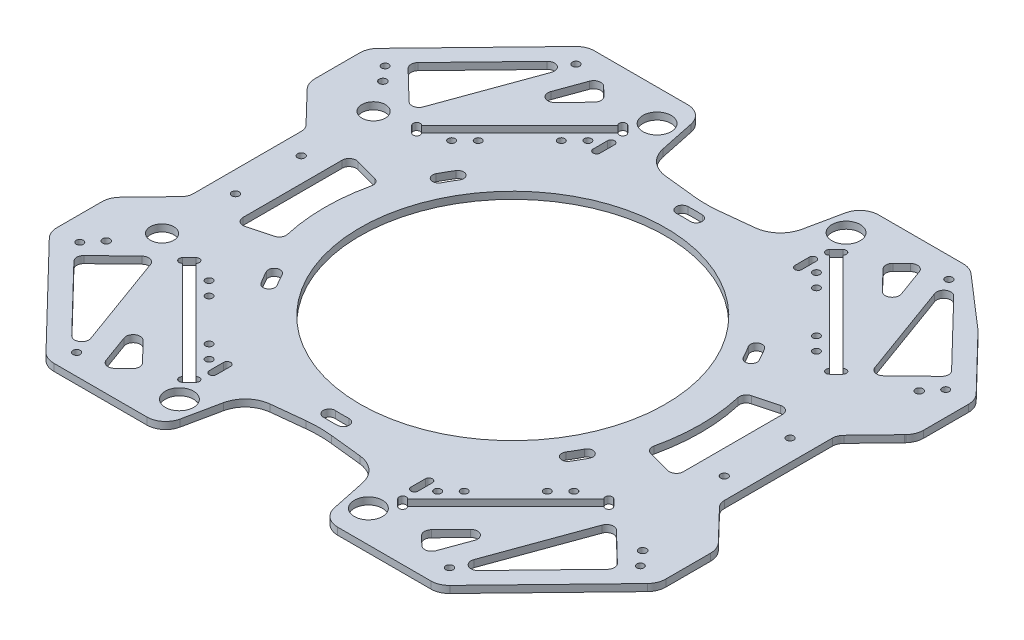
from build123d import *

# Parameters (mm, degrees)
SKETCH_2_R                                 = 1.5
SKETCH_2_R_2                               = 6
SKETCH_2_R_3                               = 2.5
SKETCH_2_R_4                               = 65
EXTRUDE_1_DEPTH                            = 3
CUT_EXTRUDE_1_DEPTH                        = 10
SKETCH_4_W                                 = 371.78166001
SKETCH_4_H                                 = 92.770790776
CUT_EXTRUDE_2_DEPTH                        = 10
CUT_EXTRUDE_3_DEPTH                        = 10
CUT_EXTRUDE_4_DEPTH                        = 10
MIRROR_3_COPY_1_DEPTH                      = 10
MIRROR_3_COPY_2_DEPTH                      = 10
SKETCH_13_R                                = 1.5
CUT_EXTRUDE_7_DEPTH                        = 10
MIRROR_4_AT_THE_SECOND_PLANE_COPY_1_SKET_R = 1.5
MIRROR_4_AT_THE_SECOND_PLANE_COPY_1_DEPTH  = 10
CUT_EXTRUDE_8_DEPTH                        = 10
FILLET_1_R                                 = 10
CUT_EXTRUDE_9_DEPTH                        = 10
FILLET_3_R                                 = 3
MIRROR_START                               = -3
MIRROR_7_DEPTH                             = 3
FILLET_4_R                                 = 10
SKETCH_27_R                                = 6
EXTRUDE_2_DEPTH                            = 3
CUT_EXTRUDE_10_DEPTH                       = 3
MIRROR_11_COPY_1_DEPTH                     = 3
FILLET_5_R                                 = 8
SKETCH_30_R                                = 5
CUT_EXTRUDE_11_DEPTH                       = 3
CUT_EXTRUDE_12_DEPTH                       = 3
FILLET_6_R                                 = 3
CUT_EXTRUDE_13_DEPTH                       = 3
FILLET_7_R                                 = 5
CUT_EXTRUDE_15_DEPTH                       = 10
PATTERN_CIRCULAR_1_COUNT                   = 6
CUT_EXTRUDE_16_DEPTH                       = 3
FILLET_8_R                                 = 8
SKETCH_35_R                                = 1.6
SKETCH_35_R_2                              = 1.55
CUT_EXTRUDE_17_DEPTH                       = 3


# Read off the part's stored shape, not the designer's step: 镜向7
with BuildPart() as part:
    # 草图2 → 凸台-拉伸1 (new body)
    with BuildSketch(Plane(origin=(0, 0, 0), x_dir=(1, 0, 0), z_dir=(0, 1, 0))):
        with BuildLine():
            Line((27.570452121, -570.945673808), (-65.284171465, -616.487071224))
            ThreePointArc((-65.284171465, -616.487071224), (-70.183566605, -620.913167557), (-72, -627.260999566))
            Line((-72, -627.260999566), (-72, -702.260999566))
            ThreePointArc((-72, -702.260999566), (-71.124572855, -706.760319382), (-68.626020199, -710.60316808))
            Line((-68.626020199, -710.60316808), (-4.161661177, -777.260999566))
            Line((-4.161661177, -777.260999566), (18.01022402, -777.260999566))
            ThreePointArc((18.01022402, -777.260999566), (25.574796805, -774.5764297), (29.754765565, -767.723872662))
            Line((29.754765565, -767.723872662), (35.416944963, -740.723008804))
            ThreePointArc((35.416944963, -740.723008804), (39.119130023, -734.339507602), (45.85666052, -731.329367302))
            Line((45.85666052, -731.329367302), (59.628943001, -729.841322608))
            ThreePointArc((59.628943001, -729.841322608), (65, -729.552003017), (70.371056999, -729.841322608))
            Line((70.371056999, -729.841322608), (84.14333948, -731.329367302))
            ThreePointArc((84.14333948, -731.329367302), (90.88747655, -734.345456618), (94.586801163, -740.740390313))
            Line((94.586801163, -740.740390313), (100.245234435, -767.723872662))
            ThreePointArc((100.245234435, -767.723872662), (104.425203195, -774.5764297), (111.98977598, -777.260999566))
            Line((111.98977598, -777.260999566), (134.161661177, -777.260999566))
            Line((134.161661177, -777.260999566), (198.626020199, -710.60316808))
            ThreePointArc((198.626020199, -710.60316808), (201.124572855, -706.760319382), (202, -702.260999566))
            Line((202, -702.260999566), (202, -627.260999566))
            ThreePointArc((202, -627.260999566), (200.183566605, -620.913167557), (195.284171465, -616.487071224))
            Line((195.284171465, -616.487071224), (102.429547879, -570.945673808))
            ThreePointArc((102.429547879, -570.945673808), (65, -562.260999566), (27.570452121, -570.945673808))
        make_face()
        with Locations(Location((-54.25, -712.220291709, 0), (0, 0, 270))):
            Circle(SKETCH_2_R, mode=Mode.SUBTRACT)
        with Locations(Location((24.797056939, -748.876687148, 0), (0, 0, 270))):
            Circle(SKETCH_2_R_2, mode=Mode.SUBTRACT)
        with BuildLine():
            Line((20.591308189, -731.989656145), (20.591308189, -725.864180236))
            ThreePointArc((20.591308189, -725.864180236), (22.091308189, -724.364180236), (23.591308189, -725.864180236))
            Line((23.591308189, -725.864180236), (23.591308189, -731.989656145))
            ThreePointArc((23.591308189, -731.989656145), (22.091308189, -733.489656145), (20.591308189, -731.989656145))
        make_face(mode=Mode.SUBTRACT)
        with Locations(Location((-60, -702.260999566, 0), (0, 0, 270))):
            Circle(SKETCH_2_R_2, mode=Mode.SUBTRACT)
        with Locations(Location((-0.081809094, -684.835999566, 0), (0, 0, 270))):
            Circle(SKETCH_2_R_3, mode=Mode.SUBTRACT)
        with Locations(Location((105.202943061, -748.876687148, 0), (0, 0, 270))):
            Circle(SKETCH_2_R_2, mode=Mode.SUBTRACT)
        with BuildLine():
            ThreePointArc((65, -724.910999566), (62.5, -722.410999566), (65, -719.910999566))
            ThreePointArc((65, -719.910999566), (67.5, -722.410999566), (65, -724.910999566))
        make_face(mode=Mode.SUBTRACT)
        with BuildLine():
            ThreePointArc((106.408691811, -725.864180236), (107.908691811, -724.364180236), (109.408691811, -725.864180236))
            Line((109.408691811, -725.864180236), (109.408691811, -731.989656145))
            ThreePointArc((109.408691811, -731.989656145), (107.908691811, -733.489656145), (106.408691811, -731.989656145))
            Line((106.408691811, -731.989656145), (106.408691811, -725.864180236))
        make_face(mode=Mode.SUBTRACT)
        with Locations(Location((184.25, -712.220291709, 0), (0, 0, 270))):
            Circle(SKETCH_2_R, mode=Mode.SUBTRACT)
        with Locations(Location((130.081809094, -684.835999566, 0), (0, 0, 270))):
            Circle(SKETCH_2_R_3, mode=Mode.SUBTRACT)
        with Locations(Location((190, -702.260999566, 0), (0, 0, 270))):
            Circle(SKETCH_2_R_2, mode=Mode.SUBTRACT)
        with Locations(Location((-60, -627.260999566, 0), (0, 0, 270))):
            Circle(SKETCH_2_R_2, mode=Mode.SUBTRACT)
        with Locations(Location((-54.25, -617.301707422, 0), (0, 0, 270))):
            Circle(SKETCH_2_R, mode=Mode.SUBTRACT)
        with Locations(Location((65, -647.260999566, 0), (0, 0, 270))):
            Circle(SKETCH_2_R_4, mode=Mode.SUBTRACT)
        with Locations(Location((-0.081809094, -609.685999566, 0), (0, 0, 270))):
            Circle(SKETCH_2_R_3, mode=Mode.SUBTRACT)
        with Locations(Location((190, -627.260999566, 0), (0, 0, 270))):
            Circle(SKETCH_2_R_2, mode=Mode.SUBTRACT)
        with Locations(Location((184.25, -617.301707422, 0), (0, 0, 270))):
            Circle(SKETCH_2_R, mode=Mode.SUBTRACT)
        with Locations(Location((130.081809094, -609.685999566, 0), (0, 0, 270))):
            Circle(SKETCH_2_R_3, mode=Mode.SUBTRACT)
        with Locations(Location((65, -572.110999566, 0), (0, 0, 270))):
            Circle(SKETCH_2_R_3, mode=Mode.SUBTRACT)
    extrude(amount=-EXTRUDE_1_DEPTH)

    # 草图3 → 切除-拉伸1 (cut)
    with BuildSketch(Plane(origin=(0, 0, 0), x_dir=(1, 0, 0), z_dir=(0, 1, 0))):
        with BuildLine():
            Line((121.515873197, -588.535574618), (85.947308959, -570.719199778))
            ThreePointArc((85.947308959, -570.719199778), (80.541899521, -572.516670259), (82.339370002, -577.922079697))
            Line((82.339370002, -577.922079697), (117.90793424, -595.738454537))
            ThreePointArc((117.90793424, -595.738454537), (123.313343678, -593.940984056), (121.515873197, -588.535574618))
        make_face()
        with BuildLine():
            ThreePointArc((138.469569232, -635.803502563), (139.848703905, -637.420135509), (141.952746293, -637.717658878))
            Line((141.952746293, -637.717658878), (165.133796995, -632.496332821))
            ThreePointArc((165.133796995, -632.496332821), (166.220460826, -631.256816273), (165.374149259, -629.842250515))
            Line((165.374149259, -629.842250515), (135.315336706, -617.056624431))
            ThreePointArc((135.315336706, -617.056624431), (133.159820875, -617.442493306), (132.649858287, -619.572066372))
            Line((132.649858287, -619.572066372), (138.469569232, -635.803502563))
        make_face()
        with BuildLine():
            ThreePointArc((47.660629998, -577.922079697), (49.458100479, -572.516670259), (44.052691041, -570.719199778))
            Line((44.052691041, -570.719199778), (8.484126803, -588.535574618))
            ThreePointArc((8.484126803, -588.535574618), (6.686656322, -593.940984056), (12.09206576, -595.738454537))
            Line((12.09206576, -595.738454537), (47.660629998, -577.922079697))
        make_face()
        with BuildLine():
            Line((-8.469569232, -635.803502563), (-2.649858287, -619.572066372))
            ThreePointArc((-2.649858287, -619.572066372), (-3.159820875, -617.442493306), (-5.315336706, -617.056624431))
            Line((-5.315336706, -617.056624431), (-35.374149259, -629.842250515))
            ThreePointArc((-35.374149259, -629.842250515), (-36.220460826, -631.256816273), (-35.133796995, -632.496332821))
            Line((-35.133796995, -632.496332821), (-11.952746293, -637.717658878))
            ThreePointArc((-11.952746293, -637.717658878), (-9.848703905, -637.420135509), (-8.469569232, -635.803502563))
        make_face()
        with BuildLine():
            Line((-60, -681.469826556), (-60, -648.052172576))
            ThreePointArc((-60, -648.052172576), (-60.552115569, -645.131724407), (-62.132254377, -642.614382464))
            Line((-62.132254377, -642.614382464), (-68.801618434, -635.417684734))
            ThreePointArc((-68.801618434, -635.417684734), (-71.171826646, -631.64167182), (-72, -627.260999566))
            Line((-72, -627.260999566), (-72, -702.260999566))
            ThreePointArc((-72, -702.260999566), (-71.171826646, -697.880327312), (-68.801618434, -694.104314398))
            Line((-68.801618434, -694.104314398), (-62.132254377, -686.907616668))
            ThreePointArc((-62.132254377, -686.907616668), (-60.552115569, -684.390274725), (-60, -681.469826556))
        make_face()
        with BuildLine():
            ThreePointArc((202, -627.260999566), (201.171826646, -631.64167182), (198.801618434, -635.417684734))
            Line((198.801618434, -635.417684734), (192.132254377, -642.614382464))
            ThreePointArc((192.132254377, -642.614382464), (190.552115569, -645.131724407), (190, -648.052172576))
            Line((190, -648.052172576), (190, -681.469826556))
            ThreePointArc((190, -681.469826556), (190.552115569, -684.390274725), (192.132254377, -686.907616668))
            Line((192.132254377, -686.907616668), (198.801618434, -694.104314398))
            ThreePointArc((198.801618434, -694.104314398), (201.171826646, -697.880327312), (202, -702.260999566))
            Line((202, -702.260999566), (202, -627.260999566))
        make_face()
    extrude(amount=-CUT_EXTRUDE_1_DEPTH, mode=Mode.SUBTRACT)

    # 草图4 → 切除-拉伸2 (cut)
    with BuildSketch(Plane.XZ.offset(3)):
        with Locations((77.214803297, 600.875604178)):
            Rectangle(SKETCH_4_W, SKETCH_4_H)
    extrude(amount=-CUT_EXTRUDE_2_DEPTH, mode=Mode.SUBTRACT)

    # 镜向1: part across plane


with BuildPart() as part_1:
    add(part.part)
    add(part.part.mirror(Plane(origin=(-108.676026708, 7, 647.260999566), x_dir=(1, 0, 0), z_dir=(0, 0, 1))))

    # 草图5 → 切除-拉伸3 (cut)
    with BuildSketch(Plane(origin=(0, 0, 0), x_dir=(1, 0, 0), z_dir=(0, 1, 0))):
        Polygon((110.753152663, -552.567853484), (156.71509344, -598.529794261), (153.886666315, -601.358221386), (107.924725538, -555.396280609), align=None)
    cut_extrude_3 = extrude(amount=-CUT_EXTRUDE_3_DEPTH, mode=Mode.SUBTRACT)

    # 草图6 → 切除-拉伸4 (cut)
    with BuildSketch(Plane(origin=(0, 0, 0), x_dir=(1, 0, 0), z_dir=(0, 1, 0))):
        with BuildLine():
            Line((107.924725538, -555.396280609), (110.753152663, -552.567853484))
            ThreePointArc((110.753152663, -552.567853484), (112.874473006, -552.567853484), (112.874473006, -554.689173828))
            Line((112.874473006, -554.689173828), (110.046045882, -557.517600953))
            ThreePointArc((110.046045882, -557.517600953), (107.924725538, -557.517600953), (107.924725538, -555.396280609))
        make_face()
        with BuildLine():
            Line((151.765345972, -599.236901043), (154.593773096, -596.408473918))
            ThreePointArc((154.593773096, -596.408473918), (156.71509344, -596.408473918), (156.71509344, -598.529794261))
            Line((156.71509344, -598.529794261), (153.886666315, -601.358221386))
            ThreePointArc((153.886666315, -601.358221386), (151.765345972, -601.358221386), (151.765345972, -599.236901043))
        make_face()
    cut_extrude_4 = extrude(amount=-CUT_EXTRUDE_4_DEPTH, mode=Mode.SUBTRACT)

    # 镜向2: 切除-拉伸3, 切除-拉伸4 across plane
    add(cut_extrude_3.mirror(Plane.ZY.offset(-65)), mode=Mode.SUBTRACT)
    add(cut_extrude_4.mirror(Plane.ZY.offset(-65)), mode=Mode.SUBTRACT)

    # 镜向3: 切除-拉伸3, 切除-拉伸4 across plane
    add(cut_extrude_3.mirror(Plane(origin=(0, 0, 647.260999566), x_dir=(1, 0, 0), z_dir=(0, 0, -1))), mode=Mode.SUBTRACT)
    add(cut_extrude_4.mirror(Plane(origin=(0, 0, 647.260999566), x_dir=(1, 0, 0), z_dir=(0, 0, -1))), mode=Mode.SUBTRACT)

    # 镜向3 copy 1 sketch → 镜向3 copy 1 (cut)
    with BuildSketch(Plane(origin=(130, 0, 1294.521999132), x_dir=(-1, 0, 0), z_dir=(0, 1, 0))):
        Polygon((110.753152663, -552.567853484), (156.71509344, -598.529794261), (153.886666315, -601.358221386), (107.924725538, -555.396280609), align=None)
    extrude(amount=-MIRROR_3_COPY_1_DEPTH, mode=Mode.SUBTRACT)

    # 镜向3 copy 2 sketch → 镜向3 copy 2 (cut)
    with BuildSketch(Plane(origin=(130, 0, 1294.521999132), x_dir=(-1, 0, 0), z_dir=(0, 1, 0))):
        with BuildLine():
            Line((107.924725538, -555.396280609), (110.753152663, -552.567853484))
            ThreePointArc((110.753152663, -552.567853484), (112.874473006, -552.567853484), (112.874473006, -554.689173828))
            Line((112.874473006, -554.689173828), (110.046045882, -557.517600953))
            ThreePointArc((110.046045882, -557.517600953), (107.924725538, -557.517600953), (107.924725538, -555.396280609))
        make_face()
        with BuildLine():
            Line((151.765345972, -599.236901043), (154.593773096, -596.408473918))
            ThreePointArc((154.593773096, -596.408473918), (156.71509344, -596.408473918), (156.71509344, -598.529794261))
            Line((156.71509344, -598.529794261), (153.886666315, -601.358221386))
            ThreePointArc((153.886666315, -601.358221386), (151.765345972, -601.358221386), (151.765345972, -599.236901043))
        make_face()
    extrude(amount=-MIRROR_3_COPY_2_DEPTH, mode=Mode.SUBTRACT)

    # 草图13 → 切除-拉伸7 (cut)
    with BuildSketch(Plane.XZ.offset(3)):
        with Locations(Location((113.616935127, 566.674633769, 0), (0, 0, 270))):
            Circle(SKETCH_13_R)
        with Locations(Location((119.273789376, 572.331488018, 0), (0, 0, 270))):
            Circle(SKETCH_13_R)
        with Locations(Location((136.951458906, 590.009157548, 0), (0, 0, 270))):
            Circle(SKETCH_13_R)
        with Locations(Location((142.608313155, 595.666011798, 0), (0, 0, 270))):
            Circle(SKETCH_13_R)
    cut_extrude_7 = extrude(amount=-CUT_EXTRUDE_7_DEPTH, mode=Mode.SUBTRACT)

    # 镜向4: 切除-拉伸7 across plane
    add(cut_extrude_7.mirror(Plane(origin=(0, 0, 647.260999566), x_dir=(1, 0, 0), z_dir=(0, 0, -1))), mode=Mode.SUBTRACT)

    # 镜向4 at the second plane: 切除-拉伸7 across plane
    add(cut_extrude_7.mirror(Plane.ZY.offset(-65)), mode=Mode.SUBTRACT)

    # 镜向4 at the second plane copy 1 sket → 镜向4 at the second plane copy 1 (cut)
    with BuildSketch(Plane(origin=(130, -3, 1294.521999132), x_dir=(-1, 0, 0), z_dir=(0, -1, 0))):
        with Locations(Location((113.616935127, 566.674633769, 0), (0, 0, 270))):
            Circle(MIRROR_4_AT_THE_SECOND_PLANE_COPY_1_SKET_R)
        with Locations(Location((119.273789376, 572.331488018, 0), (0, 0, 270))):
            Circle(MIRROR_4_AT_THE_SECOND_PLANE_COPY_1_SKET_R)
        with Locations(Location((136.951458906, 590.009157548, 0), (0, 0, 270))):
            Circle(MIRROR_4_AT_THE_SECOND_PLANE_COPY_1_SKET_R)
        with Locations(Location((142.608313155, 595.666011798, 0), (0, 0, 270))):
            Circle(MIRROR_4_AT_THE_SECOND_PLANE_COPY_1_SKET_R)
    extrude(amount=-MIRROR_4_AT_THE_SECOND_PLANE_COPY_1_DEPTH, mode=Mode.SUBTRACT)

    # 草图16 → 切除-拉伸8 (cut)
    with BuildSketch(Plane(origin=(0, 0, 0), x_dir=(1, 0, 0), z_dir=(0, 1, 0))):
        Polygon((127.376921237, -517.260999566), (169.256800533, -553.550290589), (134.161661177, -517.260999566), align=None)
    extrude(amount=-CUT_EXTRUDE_8_DEPTH, mode=Mode.SUBTRACT)

    # 圆角1
    # the kernel refuses this fillet: 10 mm, written as the material it takes off along each edge
    with BuildSketch(Plane(origin=(127.376921237, 9.324550734, 517.260999566), x_dir=(-1, 0, 0), z_dir=(0, -1, 0))) as fillet_1_piece_1:
        with BuildLine():
            CenterArc((FILLET_1_R * 0.372982029358, -FILLET_1_R), FILLET_1_R, 90, 40.909222995)
            Line((-FILLET_1_R * 0.281880446846, -FILLET_1_R * 0.244251935325), (0, 0))
            Line((0, 0), (FILLET_1_R * 0.372982029358, 0))
        make_face()
    extrude(amount=21.649101468, mode=Mode.SUBTRACT)
    with BuildSketch(Plane(origin=(169.256800533, 1.102268794, 553.550290589), x_dir=(-0.755748064674862, 0, -0.6548624762041267), z_dir=(0, -1, 0))) as fillet_1_piece_2:
        with BuildLine():
            CenterArc((FILLET_1_R * 0.0440907517567, -FILLET_1_R), FILLET_1_R, 90, 5.049157832)
            Line((-FILLET_1_R * 0.04391966001, -FILLET_1_R * 0.00388044521722), (0, 0))
            Line((0, 0), (FILLET_1_R * 0.0440907517568, 0))
        make_face()
    extrude(amount=5.204537588, mode=Mode.SUBTRACT)

    # 草图17 → 切除-拉伸9 (cut)
    with BuildSketch(Plane.XZ.offset(3)):
        Polygon((124.363711314, 549.018420922), (133.608170415, 540.078164133), (144.388273028, 569.724340914), align=None)
        Polygon((141.696012832, 535.984125249), (162.652120582, 593.615160623), (180.622995997, 576.235642885), align=None)
    extrude(amount=-CUT_EXTRUDE_9_DEPTH, mode=Mode.SUBTRACT)

    # 圆角3
    fillet_3_edges = [part_1.edges().sort_by_distance(p)[0] for p in [
        (180.622995997, -1.5, 576.235642885),
        (141.696012832, -1.5, 535.984125249),
        (162.652120582, -1.5, 593.615160623),
        (124.363711314, -1.5, 549.018420922),
        (144.388273028, -1.5, 569.724340914),
        (133.608170415, -1.5, 540.078164133),
    ]]
    fillet(fillet_3_edges, radius=FILLET_3_R)

    # 镜向7 outline → 镜向7 (cut)
    with BuildSketch(Plane(origin=(0, 0, 0), x_dir=(1, 0, 0), z_dir=(0, 1, 0)).offset(MIRROR_START)):
        with BuildLine():
            Line((-4.601377687, -559.60443543), (3.550746557, -551.174925971))
            ThreePointArc((3.550746557, -551.174925971), (4.393821833, -549.03920548), (3.479783636, -546.932878793))
            Line((3.479783636, -546.932878793), (-0.28369345, -543.29324437))
            ThreePointArc((-0.28369345, -543.29324437), (-3.043472165, -542.526496946), (-5.188625785, -544.424547555))
            Line((-5.188625785, -544.424547555), (-9.577272943, -556.493691436))
            ThreePointArc((-9.577272943, -556.493691436), (-8.348177122, -560.062702211), (-4.601377687, -559.60443543))
        make_face()
        with BuildLine():
            Line((-21.482908173, -546.104030733), (-48.537453868, -574.079137835))
            ThreePointArc((-48.537453868, -574.079137835), (-49.380529145, -576.214858326), (-48.466490947, -578.321185013))
            Line((-48.466490947, -578.321185013), (-35.976597547, -590.400080386))
            ThreePointArc((-35.976597547, -590.400080386), (-33.216818832, -591.16682781), (-31.071665212, -589.268777201))
            Line((-31.071665212, -589.268777201), (-16.507012916, -549.214774726))
            ThreePointArc((-16.507012916, -549.214774726), (-17.736108738, -545.645763952), (-21.482908173, -546.104030733))
        make_face()
        with BuildLine():
            Line((134.601377687, -734.917563702), (126.449253443, -743.347073161))
            ThreePointArc((126.449253443, -743.347073161), (125.606178167, -745.482793652), (126.520216364, -747.589120339))
            Line((126.520216364, -747.589120339), (130.28369345, -751.228754762))
            ThreePointArc((130.28369345, -751.228754762), (133.043472165, -751.995502186), (135.188625785, -750.097451577))
            Line((135.188625785, -750.097451577), (139.577272943, -738.028307696))
            ThreePointArc((139.577272943, -738.028307696), (138.348177122, -734.459296921), (134.601377687, -734.917563702))
        make_face()
        with BuildLine():
            Line((151.482908173, -748.417968399), (178.537453868, -720.442861297))
            ThreePointArc((178.537453868, -720.442861297), (179.380529145, -718.307140806), (178.466490947, -716.200814119))
            Line((178.466490947, -716.200814119), (165.976597547, -704.121918746))
            ThreePointArc((165.976597547, -704.121918746), (163.216818832, -703.355171322), (161.071665212, -705.253221931))
            Line((161.071665212, -705.253221931), (146.507012916, -745.307224406))
            ThreePointArc((146.507012916, -745.307224406), (147.736108738, -748.87623518), (151.482908173, -748.417968399))
        make_face()
        with BuildLine():
            ThreePointArc((3.479783636, -747.589120339), (4.393821833, -745.482793652), (3.550746557, -743.347073161))
            Line((3.550746557, -743.347073161), (-4.601377687, -734.917563702))
            ThreePointArc((-4.601377687, -734.917563702), (-8.348177122, -734.459296921), (-9.577272943, -738.028307696))
            Line((-9.577272943, -738.028307696), (-5.188625785, -750.097451577))
            ThreePointArc((-5.188625785, -750.097451577), (-3.043472165, -751.995502186), (-0.28369345, -751.228754762))
            Line((-0.28369345, -751.228754762), (3.479783636, -747.589120339))
        make_face()
        with BuildLine():
            ThreePointArc((-48.466490947, -716.200814119), (-49.380529145, -718.307140806), (-48.537453868, -720.442861297))
            Line((-48.537453868, -720.442861297), (-21.482908173, -748.417968399))
            ThreePointArc((-21.482908173, -748.417968399), (-17.736108738, -748.87623518), (-16.507012916, -745.307224406))
            Line((-16.507012916, -745.307224406), (-31.071665212, -705.253221931))
            ThreePointArc((-31.071665212, -705.253221931), (-33.216818832, -703.355171322), (-35.976597547, -704.121918746))
            Line((-35.976597547, -704.121918746), (-48.466490947, -716.200814119))
        make_face()
    extrude(amount=MIRROR_7_DEPTH, mode=Mode.SUBTRACT)

    # 圆角4
    fillet_4_edges = [part_1.edges().sort_by_distance(p)[0] for p in [
        (-4.161661177, -1.5, 517.260999566),
        (134.161661177, -1.5, 777.260999566),
        (-4.161661177, -1.5, 777.260999566),
    ]]
    fillet(fillet_4_edges, radius=FILLET_4_R)

    # 草图27 → 凸台-拉伸2 (add)
    with BuildSketch(Plane(origin=(0, 0, 0), x_dir=(1, 0, 0), z_dir=(0, 1, 0))):
        with Locations((190, -702.260999566)):
            Circle(SKETCH_27_R)
        with Locations((190, -592.260999566)):
            Circle(SKETCH_27_R)
        with Locations((-60, -702.260999566)):
            Circle(SKETCH_27_R)
        with Locations((-60, -592.260999566)):
            Circle(SKETCH_27_R)
    extrude(amount=-EXTRUDE_2_DEPTH)

    # 草图29 → 切除-拉伸10 (cut)
    with BuildSketch(Plane(origin=(0, 0, 0), x_dir=(1, 0, 0), z_dir=(0, 1, 0))):
        with BuildLine():
            Line((-18.603091658, -532.193815994), (30.886261292, -532.193815994))
            Line((30.886261292, -532.193815994), (29.754765565, -526.79812647))
            ThreePointArc((29.754765565, -526.79812647), (25.574796805, -519.945569432), (18.01022402, -517.260999566))
            Line((18.01022402, -517.260999566), (0.078801285, -517.260999566))
            ThreePointArc((0.078801285, -517.260999566), (-3.825166507, -518.05453252), (-7.109548881, -520.309192471))
            Line((-7.109548881, -520.309192471), (-18.603091658, -532.193815994))
        make_face()
    cut_extrude_10 = extrude(amount=-CUT_EXTRUDE_10_DEPTH, mode=Mode.SUBTRACT)

    # 镜向10: 切除-拉伸10 across plane
    add(cut_extrude_10.mirror(Plane.ZY.offset(-65)), mode=Mode.SUBTRACT)

    # 镜向11: 切除-拉伸10 across plane
    add(cut_extrude_10.mirror(Plane(origin=(0, 0, 647.260999566), x_dir=(1, 0, 0), z_dir=(0, 0, -1))), mode=Mode.SUBTRACT)

    # 镜向11 copy 1 sketch → 镜向11 copy 1 (cut)
    with BuildSketch(Plane(origin=(130, 0, 1294.521999132), x_dir=(-1, 0, 0), z_dir=(0, 1, 0))):
        with BuildLine():
            Line((-18.603091658, -532.193815994), (30.886261292, -532.193815994))
            Line((30.886261292, -532.193815994), (29.754765565, -526.79812647))
            ThreePointArc((29.754765565, -526.79812647), (25.574796805, -519.945569432), (18.01022402, -517.260999566))
            Line((18.01022402, -517.260999566), (0.078801285, -517.260999566))
            ThreePointArc((0.078801285, -517.260999566), (-3.825166507, -518.05453252), (-7.109548881, -520.309192471))
            Line((-7.109548881, -520.309192471), (-18.603091658, -532.193815994))
        make_face()
    extrude(amount=-MIRROR_11_COPY_1_DEPTH, mode=Mode.SUBTRACT)

    # 圆角5
    fillet_5_edges = [part_1.edges().sort_by_distance(p)[0] for p in [
        (-18.603091658, -1.5, 532.193815994),
        (30.886261292, -1.5, 532.193815994),
        (144.610229795, -1.5, 532.193815994),
        (99.113758937, -1.5, 532.193815994),
        (99.113758937, -1.5, 762.328183138),
        (148.603091658, -1.5, 762.328183138),
        (30.886261292, -1.5, 762.328183138),
        (-18.603091658, -1.5, 762.328183138),
    ]]
    fillet(fillet_5_edges, radius=FILLET_5_R)

    # 草图30 → 切除-拉伸11 (cut)
    with BuildSketch(Plane(origin=(0, 0, 0), x_dir=(1, 0, 0), z_dir=(0, 1, 0))):
        with Locations(Location((-40, -601.469826556, 0), (0, 0, 270))):
            Circle(SKETCH_30_R)
        with Locations(Location((-40, -691.469826556, 0), (0, 0, 270))):
            Circle(SKETCH_30_R)
    extrude(amount=-CUT_EXTRUDE_11_DEPTH, mode=Mode.SUBTRACT)

    # 草图31 → 切除-拉伸12 (cut)
    with BuildSketch(Plane(origin=(0, 0, 0), x_dir=(1, 0, 0), z_dir=(0, 1, 0))):
        with BuildLine():
            Line((-28.694443352, -622.260999566), (-28.694443352, -672.260999566))
            Line((-28.694443352, -672.260999566), (-12.295751474, -667.885422079))
            ThreePointArc((-12.295751474, -667.885422079), (-15, -647.260999566), (-12.295751474, -626.636577053))
            Line((-12.295751474, -626.636577053), (-28.694443352, -622.260999566))
        make_face()
        with BuildLine():
            Line((158.694443352, -622.260999566), (158.694443352, -672.260999566))
            Line((158.694443352, -672.260999566), (142.295751474, -667.885422079))
            ThreePointArc((142.295751474, -667.885422079), (145, -647.260999566), (142.295751474, -626.636577053))
            Line((142.295751474, -626.636577053), (158.694443352, -622.260999566))
        make_face()
    extrude(amount=-CUT_EXTRUDE_12_DEPTH, mode=Mode.SUBTRACT)

    # 圆角6
    fillet_6_edges = [part_1.edges().sort_by_distance(p)[0] for p in [
        (142.295751474, -1.5, 626.636577053),
        (158.694443352, -1.5, 622.260999566),
        (158.694443352, -1.5, 672.260999566),
        (142.295751474, -1.5, 667.885422079),
        (-28.694443352, -1.5, 622.260999566),
        (-12.295751474, -1.5, 626.636577053),
        (-12.295751474, -1.5, 667.885422079),
        (-28.694443352, -1.5, 672.260999566),
    ]]
    fillet(fillet_6_edges, radius=FILLET_6_R)

    # 草图32 → 切除-拉伸13 (cut)
    with BuildSketch(Plane(origin=(0, 0, 0), x_dir=(1, 0, 0), z_dir=(0, 1, 0))):
        with BuildLine():
            Line((-62.132254377, -607.614382464), (-48, -622.260999566))
            Line((-48, -622.260999566), (-48, -672.260999566))
            Line((-48, -672.260999566), (-62.132254377, -686.907616668))
            ThreePointArc((-62.132254377, -686.907616668), (-60.552115569, -684.390274725), (-60, -681.469826556))
            Line((-60, -681.469826556), (-60, -648.052172576))
            ThreePointArc((-60, -648.052172576), (-60.009810591, -647.656100358), (-60.0392183, -647.260999566))
            ThreePointArc((-60.0392183, -647.260999566), (-60.009810591, -646.865898774), (-60, -646.469826556))
            Line((-60, -646.469826556), (-60, -613.052172576))
            ThreePointArc((-60, -613.052172576), (-60.552115569, -610.131724407), (-62.132254377, -607.614382464))
        make_face()
        with BuildLine():
            Line((192.132254377, -686.907616668), (178, -672.260999566))
            Line((178, -672.260999566), (178, -622.260999566))
            Line((178, -622.260999566), (192.132254377, -607.614382464))
            ThreePointArc((192.132254377, -607.614382464), (190.552115569, -610.131724407), (190, -613.052172576))
            Line((190, -613.052172576), (190, -646.469826556))
            ThreePointArc((190, -646.469826556), (190.009810591, -646.865898774), (190.0392183, -647.260999566))
            ThreePointArc((190.0392183, -647.260999566), (190.009810591, -647.656100358), (190, -648.052172576))
            Line((190, -648.052172576), (190, -681.469826556))
            ThreePointArc((190, -681.469826556), (190.552115569, -684.390274725), (192.132254377, -686.907616668))
        make_face()
    extrude(amount=-CUT_EXTRUDE_13_DEPTH, mode=Mode.SUBTRACT)

    # 圆角7
    fillet_7_edges = [part_1.edges().sort_by_distance(p)[0] for p in [
        (-48, -1.5, 622.260999566),
        (-48, -1.5, 672.260999566),
        (178, -1.5, 672.260999566),
        (178, -1.5, 622.260999566),
    ]]
    fillet(fillet_7_edges, radius=FILLET_7_R)

    # 草图33 → 切除-拉伸15 (cut)
    with BuildSketch(Plane(origin=(0, 0, 0), x_dir=(1, 0, 0), z_dir=(0, 1, 0))):
        with BuildLine():
            ThreePointArc((68.099800399, -569.672896499), (65, -569.610999566), (61.900199601, -569.672896499))
            ThreePointArc((61.900199601, -569.672896499), (59.501992818, -572.27070408), (62.099800399, -574.668910863))
            ThreePointArc((62.099800399, -574.668910863), (65, -574.610999566), (67.900199601, -574.668910863))
            ThreePointArc((67.900199601, -574.668910863), (70.498007182, -572.27070408), (68.099800399, -569.672896499))
        make_face()
        with BuildLine():
            ThreePointArc((-569.672896499, -68.099800399), (-569.610999566, -65), (-569.672896499, -61.900199601))
            ThreePointArc((-569.672896499, -61.900199601), (-572.27070408, -59.501992818), (-574.668910863, -62.099800399))
            ThreePointArc((-574.668910863, -62.099800399), (-574.610999566, -65), (-574.668910863, -67.900199601))
            ThreePointArc((-574.668910863, -67.900199601), (-572.27070408, -70.498007182), (-569.672896499, -68.099800399))
        make_face()
        with BuildLine():
            ThreePointArc((-68.099800399, 569.672896499), (-65, 569.610999566), (-61.900199601, 569.672896499))
            ThreePointArc((-61.900199601, 569.672896499), (-59.501992818, 572.27070408), (-62.099800399, 574.668910863))
            ThreePointArc((-62.099800399, 574.668910863), (-65, 574.610999566), (-67.900199601, 574.668910863))
            ThreePointArc((-67.900199601, 574.668910863), (-70.498007182, 572.27070408), (-68.099800399, 569.672896499))
        make_face()
        with BuildLine():
            ThreePointArc((569.672896499, 68.099800399), (569.610999566, 65), (569.672896499, 61.900199601))
            ThreePointArc((569.672896499, 61.900199601), (572.27070408, 59.501992818), (574.668910863, 62.099800399))
            ThreePointArc((574.668910863, 62.099800399), (574.610999566, 65), (574.668910863, 67.900199601))
            ThreePointArc((574.668910863, 67.900199601), (572.27070408, 70.498007182), (569.672896499, 68.099800399))
        make_face()
    cut_extrude_15 = extrude(amount=-CUT_EXTRUDE_15_DEPTH, mode=Mode.SUBTRACT)

    # 阵列(圆周)1: 切除-拉伸15 ×6 about axis
    pattern_circular_1_axis = Axis((65, 0, 647.260999566), (0, 1, 0))
    for i in range(1, PATTERN_CIRCULAR_1_COUNT):
        add(cut_extrude_15.rotate(pattern_circular_1_axis, i * 360 / PATTERN_CIRCULAR_1_COUNT), mode=Mode.SUBTRACT)

    # 草图34 → 切除-拉伸16 (cut)
    with BuildSketch(Plane(origin=(0, 0, 0), x_dir=(1, 0, 0), z_dir=(0, 1, 0))):
        with BuildLine():
            Line((-68.626020199, -583.918831052), (-64.5, -579.652418365))
            Line((-64.5, -579.652418365), (-64.5, -605.05942379))
            Line((-64.5, -605.05942379), (-68.801618434, -600.417684734))
            ThreePointArc((-68.801618434, -600.417684734), (-71.99932041, -592.133290118), (-68.626020199, -583.918831052))
        make_face()
        with BuildLine():
            Line((-64.5, -714.869580767), (-64.5, -689.462575342))
            Line((-64.5, -689.462575342), (-68.801618434, -694.104314398))
            ThreePointArc((-68.801618434, -694.104314398), (-71.99932041, -702.388709013), (-68.626020199, -710.60316808))
            Line((-68.626020199, -710.60316808), (-64.5, -714.869580767))
        make_face()
        with BuildLine():
            Line((198.626020199, -710.60316808), (194.5, -714.869580767))
            Line((194.5, -714.869580767), (194.5, -689.462575342))
            Line((194.5, -689.462575342), (198.801618434, -694.104314398))
            ThreePointArc((198.801618434, -694.104314398), (201.99932041, -702.388709013), (198.626020199, -710.60316808))
        make_face()
        with BuildLine():
            Line((194.5, -579.652418365), (194.5, -605.05942379))
            Line((194.5, -605.05942379), (198.801618434, -600.417684734))
            ThreePointArc((198.801618434, -600.417684734), (201.99932041, -592.133290118), (198.626020199, -583.918831052))
            Line((198.626020199, -583.918831052), (194.5, -579.652418365))
        make_face()
    extrude(amount=-CUT_EXTRUDE_16_DEPTH, mode=Mode.SUBTRACT)

    # 圆角8
    fillet_8_edges = [part_1.edges().sort_by_distance(p)[0] for p in [
        (194.5, -1.5, 579.652418365),
        (194.5, -1.5, 605.05942379),
        (194.5, -1.5, 714.869580767),
        (194.5, -1.5, 689.462575342),
        (-64.5, -1.5, 714.869580767),
        (-64.5, -1.5, 689.462575342),
        (-64.5, -1.5, 579.652418365),
        (-64.5, -1.5, 605.05942379),
    ]]
    fillet(fillet_8_edges, radius=FILLET_8_R)

    # 草图35 → 切除-拉伸17 (cut)
    with BuildSketch(Plane(origin=(0, 0, 0), x_dir=(1, 0, 0), z_dir=(0, 1, 0))):
        with Locations(Location((-49.107699123, -588.430062967, 0), (0, 0, 270))):
            Circle(SKETCH_35_R)
        with Locations(Location((179.107699123, -588.430062967, 0), (0, 0, 270))):
            Circle(SKETCH_35_R)
        with Locations(Location((179.107699123, -706.091936165, 0), (0, 0, 270))):
            Circle(SKETCH_35_R)
        with Locations(Location((-49.107699123, -706.091936165, 0), (0, 0, 270))):
            Circle(SKETCH_35_R)
        with Locations(Location((169, -633.260999566, 0), (0, 0, 270))):
            Circle(SKETCH_35_R_2)
        with Locations(Location((169, -661.260999566, 0), (0, 0, 270))):
            Circle(SKETCH_35_R_2)
        with Locations(Location((-39, -661.260999566, 0), (0, 0, 270))):
            Circle(SKETCH_35_R_2)
        with Locations(Location((-39, -633.260999566, 0), (0, 0, 270))):
            Circle(SKETCH_35_R_2)
        with Locations(Location((-14.332218974, -753.49632022, 0), (0, 0, 270))):
            Circle(SKETCH_35_R_2)
        with Locations(Location((-14.332218974, -541.025678912, 0), (0, 0, 270))):
            Circle(SKETCH_35_R_2)
        with Locations(Location((144.332218974, -753.49632022, 0), (0, 0, 270))):
            Circle(SKETCH_35_R_2)
        with Locations(Location((144.332218974, -541.025678912, 0), (0, 0, 270))):
            Circle(SKETCH_35_R_2)
    extrude(amount=-CUT_EXTRUDE_17_DEPTH, mode=Mode.SUBTRACT)


solid = part_1.part
